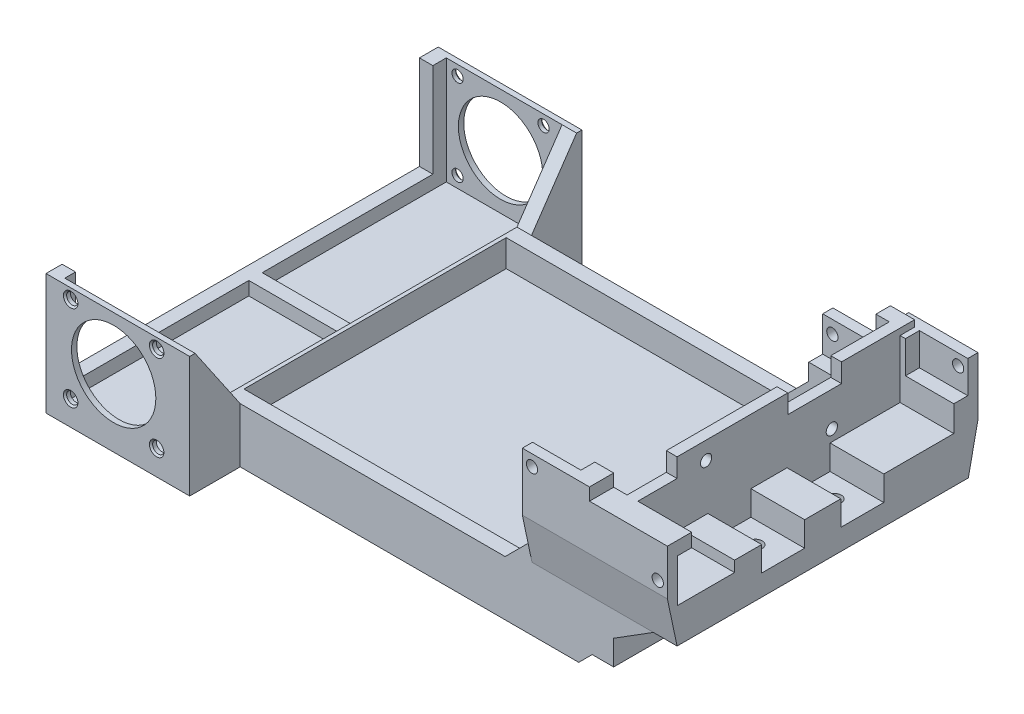
from build123d import *

# Parameters (mm, degrees)
SKETCH5_W                 = 66.8
SKETCH5_H                 = 48.8
BOSS_EXTRUDE2_DEPTH       = 5
BOSS_EXTRUDE4_START       = 2.7
BOSS_EXTRUDE4_DEPTH       = 2.7
BOSS_EXTRUDE5_DEPTH       = 1.575
SKETCH8_W                 = 17.5
SKETCH8_H                 = 54.2
BOSS_EXTRUDE6_DEPTH       = 8.5
BOSS_EXTRUDE7_DEPTH       = 54.2
SKETCH10_W                = 66.8
SKETCH10_H                = 48.8
CUT_EXTRUDE1_DEPTH        = 104.218545451
BOSS_EXTRUDE8_DEPTH       = 5
BOSS_EXTRUDE9_DEPTH       = 5
SKETCH13_W                = 4.5
SKETCH13_H                = 54.2
BOSS_EXTRUDE10_DEPTH      = 12
SKETCH15_R                = 1.25
CUT_EXTRUDE3_DEPTH        = 104.647301581
SKETCH16_W                = 13
SKETCH16_H                = 8
CUT_EXTRUDE4_DEPTH        = 4.6
SKETCH17_W                = 3
SKETCH17_H                = 54.2
CUT_EXTRUDE5_DEPTH        = 104.647301581
SKETCH18_W                = 10
SKETCH18_H                = 3.5
CUT_EXTRUDE6_DEPTH        = 80.358147817
SKETCH19_R                = 1.05
CUT_EXTRUDE7_DEPTH        = 84.32746021
SKETCH20_W                = 2.5
SKETCH20_H                = 48.8
CUT_EXTRUDE8_DEPTH        = 20
BOSS_EXTRUDE11_DEPTH      = 1.8
BOSS_EXTRUDE11_DEPTH_BACK = 2.7
SKETCH21_W                = 10
SKETCH21_H                = 5
SKETCH21_R                = 1.05
BOSS_EXTRUDE13_DEPTH      = 1.8
BOSS_EXTRUDE13_DEPTH_BACK = 2.7
SKETCH23_W                = 27
SKETCH23_H                = 10.8
SKETCH23_R                = 1.05
CUT_EXTRUDE9_DEPTH        = 2.5
CUT_EXTRUDE9_DEPTH_BACK   = 83.172170624
SKETCH24_W                = 17
SKETCH24_H                = 10.075
BOSS_EXTRUDE14_DEPTH      = 2.7
BOSS_EXTRUDE15_DEPTH      = 1.8
BOSS_EXTRUDE15_DEPTH_BACK = 2.7
SKETCH25_R                = 1.05
SKETCH26_W                = 12.5
SKETCH26_H                = 4.5
CUT_EXTRUDE10_DEPTH       = 2.6
SKETCH27_W                = 9
SKETCH27_H                = 6
CUT_EXTRUDE11_DEPTH       = 2.6
SKETCH28_W                = 9
SKETCH28_H                = 6
CUT_EXTRUDE12_DEPTH       = 2.6
CUT_EXTRUDE13_DEPTH       = 8
CUT_EXTRUDE13_DEPTH_BACK  = 2.6
SKETCH30_W                = 18.220747113
SKETCH30_H                = 10.075
BOSS_EXTRUDE16_DEPTH      = 2.7
SKETCH31_W                = 89.742279346
SKETCH31_H                = 54.809347077
BOSS_EXTRUDE17_DEPTH      = 2.5
SKETCH33_W                = 24.05
SKETCH33_H                = 2.5
BOSS_EXTRUDE18_DEPTH      = 5
SKETCH36_W                = 24.042279346
SKETCH36_H                = 9.4
BOSS_EXTRUDE20_DEPTH      = 2.5
SKETCH37_W                = 24.042279346
SKETCH37_H                = 1
BOSS_EXTRUDE21_DEPTH      = 20
CUT_EXTRUDE14_REACH       = 120.831
SKETCH38_R                = 1.05
SKETCH38_R_2              = 7.85
BOSS_EXTRUDE22_START      = -2.5
SKETCH39_W                = 2.7
SKETCH39_H                = 9.4
BOSS_EXTRUDE22_DEPTH      = 10.2
SKETCH40_W                = 2.7
SKETCH40_H                = 1
BOSS_EXTRUDE23_DEPTH      = 12.3
BOSS_EXTRUDE24_DEPTH      = 2.7
SKETCH42_W                = 2.5
SKETCH42_H                = 2
BOSS_EXTRUDE25_DEPTH      = 20
SKETCH43_W                = 24.05
SKETCH43_H                = 9.4
BOSS_EXTRUDE26_DEPTH      = 2.5
SKETCH44_W                = 24.05
SKETCH44_H                = 1
BOSS_EXTRUDE27_DEPTH      = 20
BOSS_EXTRUDE30_START      = -2.5
SKETCH45_W                = 2.7
SKETCH45_H                = 9.4
BOSS_EXTRUDE30_DEPTH      = 10.2
BOSS_EXTRUDE31_DEPTH      = 2.7
SKETCH47_W                = 2.5
SKETCH47_H                = 2.5
BOSS_EXTRUDE32_DEPTH      = 20
CUT_EXTRUDE15_START       = -1
SKETCH48_R                = 1.05
SKETCH48_R_2              = 7.85
CUT_EXTRUDE15_DEPTH       = 1
SKETCH49_W                = 2.492279346
SKETCH49_H                = 66.5
BOSS_EXTRUDE33_DEPTH      = 2.5
CHAMFER1_SIZE             = 0.3
CHAMFER2_SIZE             = 2.5
CHAMFER3_SIZE             = 5
SKETCH50_W                = 12.5
SKETCH50_H                = 2.6
CUT_EXTRUDE16_DEPTH       = 2
BOSS_EXTRUDE34_REACH      = 119.218
BOSS_EXTRUDE35_START      = -27
BOSS_EXTRUDE35_DEPTH      = 27
SKETCH53_W                = 2
SKETCH53_H                = 48.8
CUT_EXTRUDE17_DEPTH       = 5


with BuildPart() as part:
    # Sketch5 → Boss-Extrude2 (new body)
    with BuildSketch(Plane(origin=(0, 0, 0), x_dir=(1, 0, 0), z_dir=(0, 1, 0))):
        with BuildLine():
            Line((83.65, 27.1), (11.45, 27.1))
            Line((11.45, 27.1), (11.45, -27.1))
            Line((11.45, -27.1), (83.65, -27.1))
            Line((83.65, -27.1), (83.65, -3.871759936))
            ThreePointArc((83.65, -3.871759936), (82.605, 0), (83.65, 3.871759936))
            Line((83.65, 3.871759936), (83.65, 27.1))
        make_face()
        with Locations((47.55, 0)):
            Rectangle(SKETCH5_W, SKETCH5_H, mode=Mode.SUBTRACT)
    extrude(amount=BOSS_EXTRUDE2_DEPTH)

    # Sketch6 → Boss-Extrude4 (add)
    with BuildSketch(Plane.XZ.offset(BOSS_EXTRUDE4_START)):
        with BuildLine():
            Line((83.65, -3.871759936), (83.65, -27.1))
            Line((83.65, -27.1), (11.45, -27.1))
            Line((11.45, -27.1), (11.45, 27.1))
            Line((11.45, 27.1), (83.65, 27.1))
            Line((83.65, 27.1), (83.65, 3.871759936))
            ThreePointArc((83.65, 3.871759936), (82.605, 0), (83.65, -3.871759936))
        make_face()
    extrude(amount=-BOSS_EXTRUDE4_DEPTH)

    # Sketch7 → Boss-Extrude5 (add)
    with BuildSketch(Plane(origin=(0, 5, 0), x_dir=(1, 0, 0), z_dir=(0, 1, 0))):
        with BuildLine():
            Line((83.65, -27.1), (75.65, -27.1))
            Line((75.65, -27.1), (75.65, -24.4))
            Line((75.65, -24.4), (80.95, -24.4))
            Line((80.95, -24.4), (80.95, 24.4))
            Line((80.95, 24.4), (75.65, 24.4))
            Line((75.65, 24.4), (75.65, 27.1))
            Line((75.65, 27.1), (83.65, 27.1))
            Line((83.65, 27.1), (83.65, 3.871759936))
            ThreePointArc((83.65, 3.871759936), (82.605, 0), (83.65, -3.871759936))
            Line((83.65, -3.871759936), (83.65, -27.1))
        make_face()
    extrude(amount=BOSS_EXTRUDE5_DEPTH)

    # Sketch8 → Boss-Extrude6 (add)
    with BuildSketch(Plane(origin=(0, 6.575, 0), x_dir=(1, 0, 0), z_dir=(0, 1, 0))):
        with Locations((89.7, 0)):
            Rectangle(SKETCH8_W, SKETCH8_H)
    extrude(amount=BOSS_EXTRUDE6_DEPTH)

    # Sketch9 → Boss-Extrude7 (add, through all)
    with BuildSketch(Plane.XY.offset(27.1)):
        Polygon((80.95, 15.075), (75.65, 6.575), (80.95, 6.575), align=None)
    extrude(amount=-BOSS_EXTRUDE7_DEPTH)

    # Sketch10 → Cut-Extrude1 (cut, through all)
    with BuildSketch(Plane(origin=(0, 0, 0), x_dir=(1, 0, 0), z_dir=(0, 1, 0))):
        with Locations((47.55, 0)):
            Rectangle(SKETCH10_W, SKETCH10_H)
    extrude(amount=CUT_EXTRUDE1_DEPTH, mode=Mode.SUBTRACT)

    # Sketch11 → Boss-Extrude8 (add)
    with BuildSketch(Plane.XY.offset(27.1)):
        Polygon((91.05, 6.575), (83.65, 1.9375), (83.65, 6.575), align=None)
    extrude(amount=-BOSS_EXTRUDE8_DEPTH)

    # Sketch12 → Boss-Extrude9 (add)
    with BuildSketch(Plane(origin=(0, 0, -27.1), x_dir=(-1, 0, 0), z_dir=(0, 0, -1))):
        Polygon((-91.05, 6.575), (-83.65, 1.9375), (-83.65, 6.575), align=None)
    extrude(amount=-BOSS_EXTRUDE9_DEPTH)

    # Sketch13 → Boss-Extrude10 (add)
    with BuildSketch(Plane(origin=(0, 15.075, 0), x_dir=(1, 0, 0), z_dir=(0, 1, 0))):
        with Locations((83.2, 0)):
            Rectangle(SKETCH13_W, SKETCH13_H)
    extrude(amount=BOSS_EXTRUDE10_DEPTH)

    # Sketch15 → Cut-Extrude3 (cut, through all)
    with BuildSketch(Plane(origin=(0, 15.075, 0), x_dir=(1, 0, 0), z_dir=(0, 1, 0))):
        with Locations(Location((90.3, 7.366, 0), (0, 0, 270))):
            Circle(SKETCH15_R)
        with Locations(Location((90.3, -7.366, 0), (0, 0, 270))):
            Circle(SKETCH15_R)
    extrude(amount=-CUT_EXTRUDE3_DEPTH, mode=Mode.SUBTRACT)

    # Sketch16 → Cut-Extrude4 (cut)
    with BuildSketch(Plane(origin=(0, 15.075, 0), x_dir=(1, 0, 0), z_dir=(0, 1, 0))):
        with Locations((91.95, 7.366)):
            Rectangle(SKETCH16_W, SKETCH16_H)
        with Locations((91.95, -7.366)):
            Rectangle(SKETCH16_W, SKETCH16_H)
    extrude(amount=-CUT_EXTRUDE4_DEPTH, mode=Mode.SUBTRACT)

    # Sketch17 → Cut-Extrude5 (cut, through all)
    with BuildSketch(Plane(origin=(0, 15.075, 0), x_dir=(1, 0, 0), z_dir=(0, 1, 0))):
        with Locations((96.95, 0)):
            Rectangle(SKETCH17_W, SKETCH17_H)
    extrude(amount=-CUT_EXTRUDE5_DEPTH, mode=Mode.SUBTRACT)

    # Sketch18 → Cut-Extrude6 (cut, through all)
    with BuildSketch(Plane.ZY.offset(-80.95)):
        with Locations((-8.5, 25.325)):
            Rectangle(SKETCH18_W, SKETCH18_H)
    extrude(amount=-CUT_EXTRUDE6_DEPTH, mode=Mode.SUBTRACT)

    # Sketch19 → Cut-Extrude7 (cut, through all)
    with BuildSketch(Plane(origin=(85.45, 0, 0), x_dir=(0, 0, -1), z_dir=(1, 0, 0))):
        with Locations((-11.7, 23.775)):
            Circle(SKETCH19_R)
        with Locations((11.7, 17.175)):
            Circle(SKETCH19_R)
    extrude(amount=-CUT_EXTRUDE7_DEPTH, mode=Mode.SUBTRACT)

    # Sketch20 → Cut-Extrude8 (cut)
    with BuildSketch(Plane(origin=(0, 27.075, 0), x_dir=(1, 0, 0), z_dir=(0, 1, 0))):
        with Locations((82.2, 0)):
            Rectangle(SKETCH20_W, SKETCH20_H)
    extrude(amount=-CUT_EXTRUDE8_DEPTH, mode=Mode.SUBTRACT)

    # Sketch21 → Boss-Extrude11 (add, two sides: drawn at the far end of the back side and taken through both)
    with BuildSketch(Plane.XY.offset(27.1).offset(-BOSS_EXTRUDE11_DEPTH_BACK)):
        with Locations((90.45, 17.575)):
            Rectangle(SKETCH21_W, SKETCH21_H)
        with Locations((93.65, 17.175)):
            Circle(SKETCH21_R, mode=Mode.SUBTRACT)
    extrude(amount=BOSS_EXTRUDE11_DEPTH + BOSS_EXTRUDE11_DEPTH_BACK)

    # Sketch23 → Boss-Extrude13 (add, two sides: drawn at the far end of the back side and taken through both)
    with BuildSketch(Plane.XY.offset(27.1).offset(-BOSS_EXTRUDE13_DEPTH_BACK)):
        with Locations((81.95, 20.475)):
            Rectangle(SKETCH23_W, SKETCH23_H)
        with Locations((70.25, 23.775)):
            Circle(SKETCH23_R, mode=Mode.SUBTRACT)
        with Locations((93.65, 17.175)):
            Circle(SKETCH23_R, mode=Mode.SUBTRACT)
    extrude(amount=BOSS_EXTRUDE13_DEPTH + BOSS_EXTRUDE13_DEPTH_BACK)

    # Sketch22 → Cut-Extrude9 (cut, two sides: drawn at the far end of the back side and taken through both)
    with BuildSketch(Plane.ZY.offset(-83.45).offset(-CUT_EXTRUDE9_DEPTH_BACK)):
        Polygon((34.491606827, 27.075), (17.1, 27.075), (17.1, 23.575), (27.966612244, 23.575), (34.491606827, 23.575), align=None)
    extrude(amount=CUT_EXTRUDE9_DEPTH + CUT_EXTRUDE9_DEPTH_BACK, mode=Mode.SUBTRACT)

    # Sketch24 → Boss-Extrude14 (add)
    with BuildSketch(Plane.XY.offset(27.1)):
        with Locations((76.95, 10.0375)):
            Rectangle(SKETCH24_W, SKETCH24_H)
    extrude(amount=-BOSS_EXTRUDE14_DEPTH)

    # Sketch25 → Boss-Extrude15 (add, two sides: drawn at the far end of the back side and taken through both)
    with BuildSketch(Plane(origin=(0, 0, -27.1), x_dir=(-1, 0, 0), z_dir=(0, 0, -1)).offset(-BOSS_EXTRUDE15_DEPTH_BACK)):
        Polygon((-95.45, 15.075), (-68.45, 15.075), (-68.45, 19.575), (-77.45, 19.575), (-82.55, 25.875), (-95.45, 25.875), align=None)
        with Locations((-93.65, 23.775)):
            Circle(SKETCH25_R, mode=Mode.SUBTRACT)
        with Locations((-70.25, 17.175)):
            Circle(SKETCH25_R, mode=Mode.SUBTRACT)
    extrude(amount=BOSS_EXTRUDE15_DEPTH + BOSS_EXTRUDE15_DEPTH_BACK)

    # Sketch26 → Cut-Extrude10 (cut)
    with BuildSketch(Plane.XY.offset(-24.4)):
        with Locations((74.7, 17.325)):
            Rectangle(SKETCH26_W, SKETCH26_H)
    extrude(amount=-CUT_EXTRUDE10_DEPTH, mode=Mode.SUBTRACT)

    # Sketch27 → Cut-Extrude11 (cut)
    with BuildSketch(Plane(origin=(0, 0, 24.4), x_dir=(-1, 0, 0), z_dir=(0, 0, -1))):
        with Locations((-72.95, 22.875)):
            Rectangle(SKETCH27_W, SKETCH27_H)
    extrude(amount=-CUT_EXTRUDE11_DEPTH, mode=Mode.SUBTRACT)

    # Sketch28 → Cut-Extrude12 (cut)
    with BuildSketch(Plane.XY.offset(-24.4)):
        with Locations((90.95, 22.875)):
            Rectangle(SKETCH28_W, SKETCH28_H)
    extrude(amount=-CUT_EXTRUDE12_DEPTH, mode=Mode.SUBTRACT)

    # Sketch29 → Cut-Extrude13 (cut, two sides: drawn at the far end of the back side and taken through both)
    with BuildSketch(Plane(origin=(0, 0, 24.4), x_dir=(-1, 0, 0), z_dir=(0, 0, -1)).offset(-CUT_EXTRUDE13_DEPTH_BACK)):
        Polygon((-95.45, 15.075), (-95.45, 13.075), (-86.45, 13.075), (-86.45, 21.075), (-95.45, 21.075), align=None)
    extrude(amount=CUT_EXTRUDE13_DEPTH + CUT_EXTRUDE13_DEPTH_BACK, mode=Mode.SUBTRACT)

    # Sketch30 → Boss-Extrude16 (add)
    with BuildSketch(Plane(origin=(0, 0, -27.1), x_dir=(-1, 0, 0), z_dir=(0, 0, -1))):
        with Locations((-77.560373556, 10.0375)):
            Rectangle(SKETCH30_W, SKETCH30_H)
    extrude(amount=-BOSS_EXTRUDE16_DEPTH)

    # Sketch31 → Boss-Extrude17 (add)
    with BuildSketch(Plane.XZ.offset(2.7)):
        with Locations((32.278860327, -0.304673538)):
            Rectangle(SKETCH31_W, SKETCH31_H)
    extrude(amount=BOSS_EXTRUDE17_DEPTH)

    # Sketch33 → Boss-Extrude18 (add)
    with BuildSketch(Plane.XZ.offset(5.2)):
        with Locations((-0.575, 0)):
            Rectangle(SKETCH33_W, SKETCH33_H)
    extrude(amount=-BOSS_EXTRUDE18_DEPTH)

    # Sketch36 → Boss-Extrude20 (add)
    with BuildSketch(Plane.XZ.offset(5.2)):
        with Locations((-0.571139673, 31.8)):
            Rectangle(SKETCH36_W, SKETCH36_H)
    extrude(amount=-BOSS_EXTRUDE20_DEPTH)

    # Sketch37 → Boss-Extrude21 (add)
    with BuildSketch(Plane(origin=(0, -2.7, 0), x_dir=(1, 0, 0), z_dir=(0, 1, 0))):
        with Locations((-0.571139673, -36)):
            Rectangle(SKETCH37_W, SKETCH37_H)
    extrude(amount=BOSS_EXTRUDE21_DEPTH)

    # Sketch38 → Cut-Extrude14 (cut, up to next)
    with BuildSketch(Plane.XY.offset(36.5), mode=Mode.PRIVATE) as cut_extrude14_sk1:
        with Locations((8, 15.4)):
            Circle(SKETCH38_R)
    cut_extrude14_tool1 = extrude(cut_extrude14_sk1.sketch, amount=-CUT_EXTRUDE14_REACH, mode=Mode.PRIVATE) & part.part
    # Sketch38 → Cut-Extrude14 (cut, up to next)
    with BuildSketch(Plane.XY.offset(36.5), mode=Mode.PRIVATE) as cut_extrude14_sk2:
        with Locations((8, -0.6)):
            Circle(SKETCH38_R)
    cut_extrude14_tool2 = extrude(cut_extrude14_sk2.sketch, amount=-CUT_EXTRUDE14_REACH, mode=Mode.PRIVATE) & part.part
    # Sketch38 → Cut-Extrude14 (cut, up to next)
    with BuildSketch(Plane.XY.offset(36.5), mode=Mode.PRIVATE) as cut_extrude14_sk3:
        with Locations((-8, 15.4)):
            Circle(SKETCH38_R)
    cut_extrude14_tool3 = extrude(cut_extrude14_sk3.sketch, amount=-CUT_EXTRUDE14_REACH, mode=Mode.PRIVATE) & part.part
    # Sketch38 → Cut-Extrude14 (cut, up to next)
    with BuildSketch(Plane.XY.offset(36.5), mode=Mode.PRIVATE) as cut_extrude14_sk4:
        with Locations((-8, -0.6)):
            Circle(SKETCH38_R)
    cut_extrude14_tool4 = extrude(cut_extrude14_sk4.sketch, amount=-CUT_EXTRUDE14_REACH, mode=Mode.PRIVATE) & part.part
    # Sketch38 → Cut-Extrude14 (cut, up to next)
    with BuildSketch(Plane.XY.offset(36.5), mode=Mode.PRIVATE) as cut_extrude14_sk5:
        with Locations((0, 7.4)):
            Circle(SKETCH38_R_2)
    cut_extrude14_tool5 = extrude(cut_extrude14_sk5.sketch, amount=-CUT_EXTRUDE14_REACH, mode=Mode.PRIVATE) & part.part
    add(cut_extrude14_tool1.solids().sort_by_distance((8, 15.4, 36.5))[0], mode=Mode.SUBTRACT)
    add(cut_extrude14_tool2.solids().sort_by_distance((8, -0.6, 36.5))[0], mode=Mode.SUBTRACT)
    add(cut_extrude14_tool3.solids().sort_by_distance((-8, 15.4, 36.5))[0], mode=Mode.SUBTRACT)
    add(cut_extrude14_tool4.solids().sort_by_distance((-8, -0.6, 36.5))[0], mode=Mode.SUBTRACT)
    add(cut_extrude14_tool5.solids().sort_by_distance((0, 7.4, 36.5))[0], mode=Mode.SUBTRACT)

    # Sketch39 → Boss-Extrude22 (add)
    with BuildSketch(Plane(origin=(0, -2.7, 0), x_dir=(1, 0, 0), z_dir=(0, 1, 0)).offset(BOSS_EXTRUDE22_START)):
        with Locations((12.8, -31.8)):
            Rectangle(SKETCH39_W, SKETCH39_H)
    extrude(amount=BOSS_EXTRUDE22_DEPTH)

    # Sketch40 → Boss-Extrude23 (add)
    with BuildSketch(Plane(origin=(0, 5, 0), x_dir=(1, 0, 0), z_dir=(0, 1, 0))):
        with Locations((12.8, -36)):
            Rectangle(SKETCH40_W, SKETCH40_H)
    extrude(amount=BOSS_EXTRUDE23_DEPTH)

    # Sketch41 → Boss-Extrude24 (add)
    with BuildSketch(Plane(origin=(14.15, 0, 0), x_dir=(0, 0, -1), z_dir=(1, 0, 0))):
        Polygon((-27.1, 5), (-35.5, 17.3), (-35.5, 5), align=None)
    extrude(amount=-BOSS_EXTRUDE24_DEPTH)

    # Sketch42 → Boss-Extrude25 (add)
    with BuildSketch(Plane(origin=(0, -2.7, 0), x_dir=(1, 0, 0), z_dir=(0, 1, 0))):
        with Locations((-11.342279346, -34.5)):
            Rectangle(SKETCH42_W, SKETCH42_H)
    extrude(amount=BOSS_EXTRUDE25_DEPTH)

    # Sketch43 → Boss-Extrude26 (add)
    with BuildSketch(Plane(origin=(0, -2.7, 0), x_dir=(1, 0, 0), z_dir=(0, 1, 0))):
        with Locations((-0.575, 31.8)):
            Rectangle(SKETCH43_W, SKETCH43_H)
    extrude(amount=-BOSS_EXTRUDE26_DEPTH)

    # Sketch44 → Boss-Extrude27 (add)
    with BuildSketch(Plane(origin=(0, -2.7, 0), x_dir=(1, 0, 0), z_dir=(0, 1, 0))):
        with Locations((-0.575, 36)):
            Rectangle(SKETCH44_W, SKETCH44_H)
    extrude(amount=BOSS_EXTRUDE27_DEPTH)

    # Sketch45 → Boss-Extrude30 (add)
    with BuildSketch(Plane(origin=(0, -2.7, 0), x_dir=(1, 0, 0), z_dir=(0, 1, 0)).offset(BOSS_EXTRUDE30_START)):
        with Locations((12.8, 31.8)):
            Rectangle(SKETCH45_W, SKETCH45_H)
    extrude(amount=BOSS_EXTRUDE30_DEPTH)

    # Sketch46 → Boss-Extrude31 (add)
    with BuildSketch(Plane(origin=(14.15, 0, 0), x_dir=(0, 0, -1), z_dir=(1, 0, 0))):
        Polygon((27.1, 5), (35.5, 17.3), (36.5, 17.3), (36.5, 5), align=None)
    extrude(amount=-BOSS_EXTRUDE31_DEPTH)

    # Sketch47 → Boss-Extrude32 (add)
    with BuildSketch(Plane(origin=(0, -2.7, 0), x_dir=(1, 0, 0), z_dir=(0, 1, 0))):
        with Locations((-11.35, 34.25)):
            Rectangle(SKETCH47_W, SKETCH47_H)
    extrude(amount=BOSS_EXTRUDE32_DEPTH)

    # Sketch48 → Cut-Extrude15 (cut)
    with BuildSketch(Plane(origin=(0, 0, -36.5), x_dir=(-1, 0, 0), z_dir=(0, 0, -1)).offset(CUT_EXTRUDE15_START)):
        with Locations(Location((8, 15.4, 0), (0, 0, 180))):
            Circle(SKETCH48_R)
        with Locations(Location((-8, 15.4, 0), (0, 0, 180))):
            Circle(SKETCH48_R)
        with Locations(Location((-8, -0.6, 0), (0, 0, 180))):
            Circle(SKETCH48_R)
        with Locations(Location((8, -0.6, 0), (0, 0, 180))):
            Circle(SKETCH48_R)
        with Locations(Location((0, 7.4, 0), (0, 0, 180))):
            Circle(SKETCH48_R_2)
    extrude(amount=CUT_EXTRUDE15_DEPTH, mode=Mode.SUBTRACT)

    # Sketch49 → Boss-Extrude33 (add)
    with BuildSketch(Plane(origin=(0, -2.7, 0), x_dir=(1, 0, 0), z_dir=(0, 1, 0))):
        with Locations((-11.346139673, -0.25)):
            Rectangle(SKETCH49_W, SKETCH49_H)
    extrude(amount=BOSS_EXTRUDE33_DEPTH)

    # Chamfer1
    chamfer1_edges = [part.edges().sort_by_distance(p)[0] for p in [
        (6.95, -0.6, 36.5),
        (-9.05, 15.4, 36.5),
        (-9.05, -0.6, 36.5),
        (6.95, 15.4, 36.5),
        (6.95, 15.4, -36.5),
        (6.95, -0.6, -36.5),
        (-9.05, -0.6, -36.5),
        (-9.05, 15.4, -36.5),
    ]]
    chamfer(chamfer1_edges, length=CHAMFER1_SIZE)

    # Chamfer2
    chamfer2_edges = [part.edges().sort_by_distance(p)[0] for p in [
        (77.15, -2.7, 0),
    ]]
    chamfer(chamfer2_edges, length=CHAMFER2_SIZE - 0.0001)  # a hair under: the kernel refuses the full size

    # Chamfer3
    chamfer3_edges = [part.edges().sort_by_distance(p)[0] for p in [
        (68.45, 5, 25.75),
        (68.45, 5, -25.75),
    ]]
    chamfer(chamfer3_edges, length=CHAMFER3_SIZE)

    # Sketch50 → Cut-Extrude16 (cut)
    with BuildSketch(Plane(origin=(0, 15.075, 0), x_dir=(1, 0, 0), z_dir=(0, 1, 0))):
        with Locations((74.7, 25.7)):
            Rectangle(SKETCH50_W, SKETCH50_H)
    extrude(amount=-CUT_EXTRUDE16_DEPTH, mode=Mode.SUBTRACT)

    # Boss-Extrude34: up to this face of the body (flat: up to its plane)
    boss_extrude34_end = Plane(part.part.faces().sort_by_distance((68.45, 17.344469648, 26.703268026))[0])
    # Sketch51 → Boss-Extrude34 (add, up to the picked face)
    with BuildSketch(Plane(origin=(95.45, 0, 0), x_dir=(0, 0, -1), z_dir=(1, 0, 0)), mode=Mode.PRIVATE) as boss_extrude34_sk1:
        Polygon((-28.9, 15.075), (-27.1, 6.575), (-27.1, 15.075), align=None)
    boss_extrude34_tool1 = split(extrude(boss_extrude34_sk1.sketch, amount=-BOSS_EXTRUDE34_REACH, mode=Mode.PRIVATE), bisect_by=boss_extrude34_end, keep=Keep.BOTH, mode=Mode.PRIVATE)
    add(boss_extrude34_tool1.solids().sort_by(Axis((95.45, 12.241667, 27.7), (-1, 0, 0)))[0])

    # Sketch52 → Boss-Extrude35 (add)
    with BuildSketch(Plane(origin=(95.45, 0, 0), x_dir=(0, 0, -1), z_dir=(1, 0, 0)).offset(BOSS_EXTRUDE35_START)):
        Polygon((28.9, 15.075), (27.1, 6.575), (27.1, 15.075), align=None)
    extrude(amount=BOSS_EXTRUDE35_DEPTH)

    # Sketch53 → Cut-Extrude17 (cut)
    with BuildSketch(Plane(origin=(0, 5, 0), x_dir=(1, 0, 0), z_dir=(0, 1, 0))):
        with Locations((13.15, 0)):
            Rectangle(SKETCH53_W, SKETCH53_H)
    extrude(amount=-CUT_EXTRUDE17_DEPTH, mode=Mode.SUBTRACT)


solid = part.part
